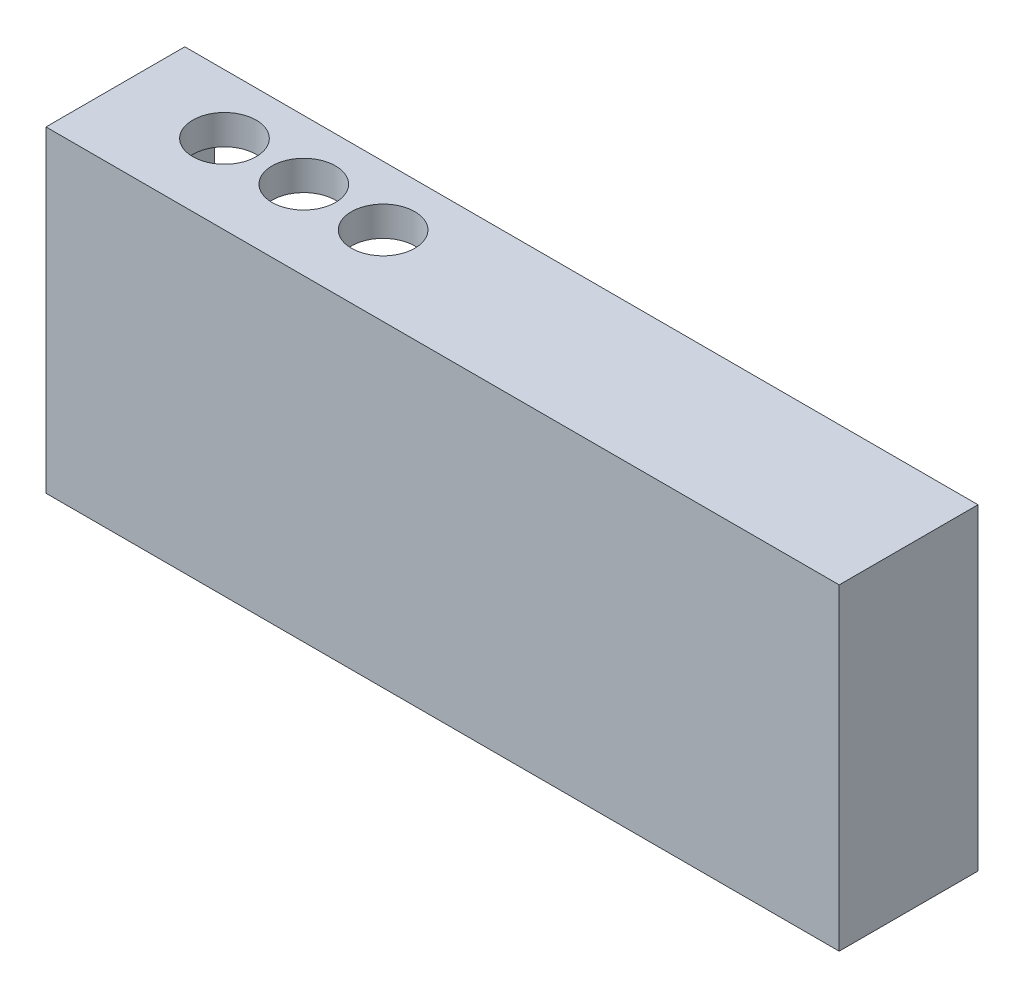
from build123d import *

# Parameters (mm, degrees)
CROQUIS1_W              = 200
CROQUIS1_H              = 80
SALIENTE_EXTRUIR1_DEPTH = 35
CROQUIS2_W              = 185
CROQUIS2_H              = 65
CORTAR_EXTRUIR1_DEPTH   = 27.5
CROQUIS3_R              = 8
CORTAR_EXTRUIR2_DEPTH   = 7.5
CROQUIS4_R              = 5.4
CORTAR_EXTRUIR3_DEPTH   = 7.5
CROQUIS5_R              = 2.50919292
CORTAR_EXTRUIR4_DEPTH   = 2


with BuildPart() as part:
    # Croquis1 → Saliente-Extruir1 (new body)
    with BuildSketch(Plane.XY):
        Rectangle(CROQUIS1_W, CROQUIS1_H)
    extrude(amount=SALIENTE_EXTRUIR1_DEPTH)

    # Croquis2 → Cortar-Extruir1 (cut)
    with BuildSketch(Plane(origin=(0, 0, 0), x_dir=(-1, 0, 0), z_dir=(0, 0, -1))):
        Rectangle(CROQUIS2_W, CROQUIS2_H)
    extrude(amount=-CORTAR_EXTRUIR1_DEPTH, mode=Mode.SUBTRACT)

    # Croquis3 → Cortar-Extruir2 (cut)
    with BuildSketch(Plane(origin=(0, 40, 0), x_dir=(1, 0, 0), z_dir=(0, 1, 0))):
        with Locations((-75, -15)):
            Circle(CROQUIS3_R)
        with Locations((-55, -15)):
            Circle(CROQUIS3_R)
        with Locations((-35, -15)):
            Circle(CROQUIS3_R)
    extrude(amount=-CORTAR_EXTRUIR2_DEPTH, mode=Mode.SUBTRACT)

    # Croquis4 → Cortar-Extruir3 (cut)
    with BuildSketch(Plane.XZ.offset(40)):
        with Locations((75, 17.5)):
            Circle(CROQUIS4_R)
    extrude(amount=-CORTAR_EXTRUIR3_DEPTH, mode=Mode.SUBTRACT)

    # Croquis5 → Cortar-Extruir4 (cut)
    with BuildSketch(Plane(origin=(0, 0, 0), x_dir=(-1, 0, 0), z_dir=(0, 0, -1))):
        with Locations((96.25, -36.25)):
            Circle(CROQUIS5_R)
        with Locations((-96.25, -36.25)):
            Circle(CROQUIS5_R)
        with Locations((-96.25, 36.25)):
            Circle(CROQUIS5_R)
        with Locations((96.25, 36.25)):
            Circle(CROQUIS5_R)
    extrude(amount=-CORTAR_EXTRUIR4_DEPTH, mode=Mode.SUBTRACT)


solid = part.part
